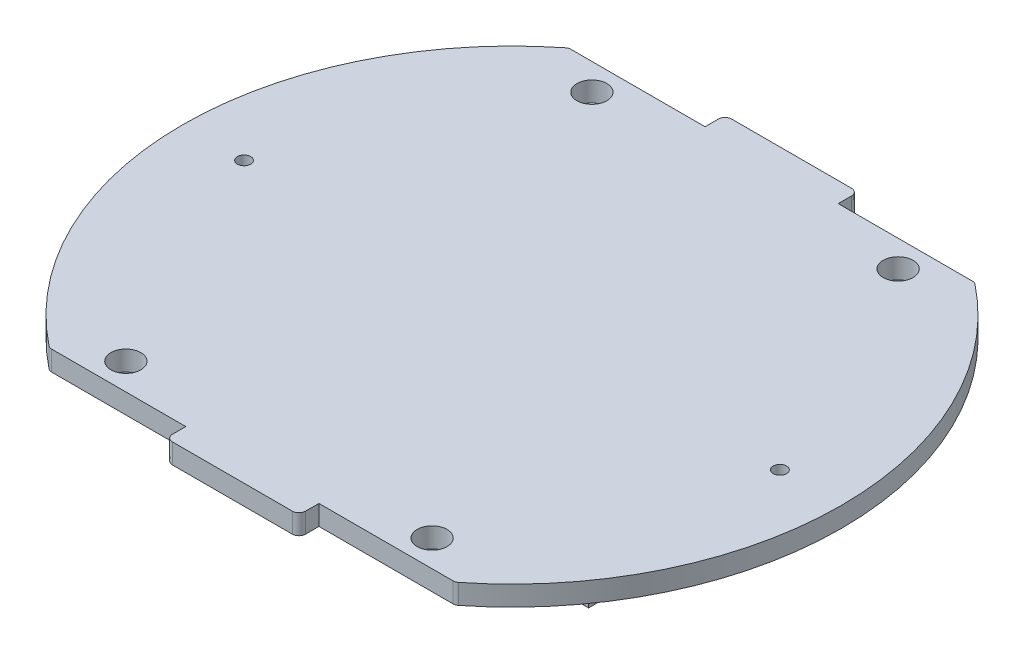
from build123d import *

# Parameters (mm, degrees)
A_BASE_T42_OUTLINE_R              = 2.2479
A_BASE_T42_OUTLINE_R_2            = 1
A_BASE_T42_DEPTH                  = 3
OUTER_RIM_CUT_DEPTH               = 68.299702823
SKETCH2_W                         = 20
SKETCH2_H                         = 3
FLANGES_DEPTH                     = 3
CONTOURING_R                      = 1
SKETCH3_W                         = 15
SKETCH3_H                         = 3
BASE_SUPPORTS_DEPTH               = 3
BASE_SUPPORTS_CHAMFER_SIZE        = 3
SKETCH4_W                         = 3
SKETCH4_H                         = 45
DYNAMIXEL_SIDE_SUPPORTS_DEPTH     = 6.85
SKETCH5_W                         = 12
SKETCH5_H                         = 3
DYNAMIXEL_SIDE_SUPPORT_ENDS_DEPTH = 9.85
SKETCH8_W                         = 9
SKETCH8_H                         = 45
DYNAMIXEL_OFFSET_DEPTH            = 1.25
DYNAMIXEL_CONTOURING_R            = 1


# Read off the part's stored shape, not the designer's step: a_base_t42
with BuildPart() as part:
    # a_base_t42 outline → a_base_t42 (new body)
    with BuildSketch(Plane(origin=(0, 0, 0), x_dir=(1, 0, 0), z_dir=(0, 1, 0))):
        with BuildLine():
            ThreePointArc((31.5, -42), (52.5, 0), (31.5, 42))
            Line((31.5, 42), (-31.5, 42))
            ThreePointArc((-31.5, 42), (-52.5, 0), (-31.5, -42))
            Line((-31.5, -42), (31.5, -42))
        make_face()
        with Locations((-23, -35)):
            Circle(A_BASE_T42_OUTLINE_R, mode=Mode.SUBTRACT)
        with Locations((23, -35)):
            Circle(A_BASE_T42_OUTLINE_R, mode=Mode.SUBTRACT)
        with Locations((-40.25, 0)):
            Circle(A_BASE_T42_OUTLINE_R_2, mode=Mode.SUBTRACT)
        with Locations((-23, 35)):
            Circle(A_BASE_T42_OUTLINE_R, mode=Mode.SUBTRACT)
        with Locations((40.25, 0)):
            Circle(A_BASE_T42_OUTLINE_R_2, mode=Mode.SUBTRACT)
        with Locations((23, 35)):
            Circle(A_BASE_T42_OUTLINE_R, mode=Mode.SUBTRACT)
    extrude(amount=A_BASE_T42_DEPTH)

    # Sketch1 → Outer Rim Cut (cut, through all)
    with BuildSketch(Plane.XZ):
        with BuildLine():
            Line((31.5, 42), (-31.5, 42))
            ThreePointArc((-31.5, 42), (-52.5, 0), (-31.5, -42))
            Line((-31.5, -42), (31.5, -42))
            ThreePointArc((31.5, -42), (52.5, 0), (31.5, 42))
        make_face()
        with BuildLine():
            Line((30.483602149, 39), (-30.483602149, 39))
            ThreePointArc((-30.483602149, 39), (-49.5, 0), (-30.483602149, -39))
            Line((-30.483602149, -39), (30.483602149, -39))
            ThreePointArc((30.483602149, -39), (49.5, 0), (30.483602149, 39))
        make_face(mode=Mode.SUBTRACT)
    extrude(amount=-OUTER_RIM_CUT_DEPTH, mode=Mode.SUBTRACT)

    # Sketch2 → Flanges (add)
    with BuildSketch(Plane.XZ):
        with Locations((0, -40.5)):
            Rectangle(SKETCH2_W, SKETCH2_H)
        with Locations((0, 40.5)):
            Rectangle(SKETCH2_W, SKETCH2_H)
    extrude(amount=-FLANGES_DEPTH)

    # Contouring
    contouring_edges = [part.edges().sort_by_distance(p)[0] for p in [
        (30.483602149, 1.5, -39),
        (-30.483602149, 1.5, -39),
        (10, 1.5, -42),
        (-10, 1.5, -42),
        (30.483602149, 1.5, 39),
        (-30.483602149, 1.5, 39),
        (10, 1.5, 42),
        (-10, 1.5, 42),
    ]]
    fillet(contouring_edges, radius=CONTOURING_R)

    # Sketch3 → Base Supports (add)
    with BuildSketch(Plane.XZ):
        with Locations((0, -27)):
            Rectangle(SKETCH3_W, SKETCH3_H)
        with Locations((0, 27)):
            Rectangle(SKETCH3_W, SKETCH3_H)
    extrude(amount=BASE_SUPPORTS_DEPTH)

    # Base Supports Chamfer
    base_supports_chamfer_edges = [part.edges().sort_by_distance(p)[0] for p in [
        (0, 0, 28.5),
        (0, 0, -28.5),
    ]]
    chamfer(base_supports_chamfer_edges, length=BASE_SUPPORTS_CHAMFER_SIZE - 0.0001)  # a hair under: the kernel refuses the full size

    # Sketch4 → Dynamixel Side Supports (add)
    with BuildSketch(Plane.XZ):
        with Locations((-32.5, 0)):
            Rectangle(SKETCH4_W, SKETCH4_H)
        with Locations((32.5, 0)):
            Rectangle(SKETCH4_W, SKETCH4_H)
    extrude(amount=DYNAMIXEL_SIDE_SUPPORTS_DEPTH)

    # Sketch5 → Dynamixel Side Support Ends (add)
    with BuildSketch(Plane.XZ):
        with Locations((-28, 24)):
            Rectangle(SKETCH5_W, SKETCH5_H)
        with Locations((28, -24)):
            Rectangle(SKETCH5_W, SKETCH5_H)
    extrude(amount=DYNAMIXEL_SIDE_SUPPORT_ENDS_DEPTH)

    # Sketch8 → Dynamixel Offset (add)
    with BuildSketch(Plane.XZ):
        with Locations((-26.5, 0)):
            Rectangle(SKETCH8_W, SKETCH8_H)
        with Locations((26.5, 0)):
            Rectangle(SKETCH8_W, SKETCH8_H)
    extrude(amount=DYNAMIXEL_OFFSET_DEPTH)

    # Dynamixel Contouring
    dynamixel_contouring_edges = [part.edges().sort_by_distance(p)[0] for p in [
        (-31, -4.05, -22.5),
        (31, -4.05, 22.5),
        (-34, -4.925, 25.5),
        (-22, -5.55, 22.5),
        (-28, -9.85, 22.5),
        (34, -4.925, -25.5),
        (22, -5.55, -22.5),
        (28, -9.85, -22.5),
        (-22, -0.625, -22.5),
        (22, -0.625, 22.5),
    ]]
    fillet(dynamixel_contouring_edges, radius=DYNAMIXEL_CONTOURING_R)


solid = part.part
